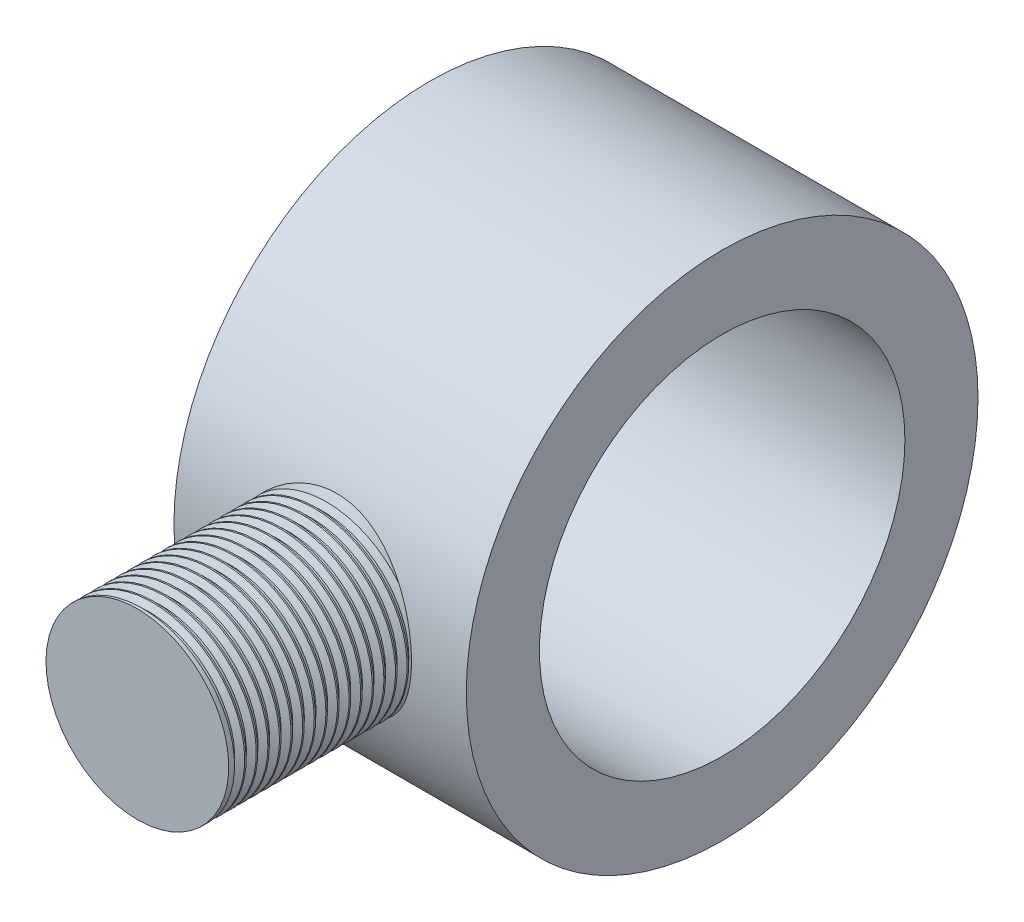
from build123d import *

# Parameters (mm, degrees)
SKETCH1_R           = 7
BOSS_EXTRUDE1_DEPTH = 8
SKETCH2_R           = 5
CUT_EXTRUDE1_DEPTH  = 13.727922061
SKETCH3_R           = 2.5
BOSS_EXTRUDE3_DEPTH = 1
BOSS_EXTRUDE4_START = 5
SKETCH4_R           = 2.5
BOSS_EXTRUDE4_DEPTH = 5
THREAD1_PITCH       = 0.3175


with BuildPart() as part:
    # Sketch1 → Boss-Extrude1 (new body)
    with BuildSketch(Plane(origin=(0, 0, 0), x_dir=(0, 0, -1), z_dir=(1, 0, 0))):
        Circle(SKETCH1_R)
    extrude(amount=BOSS_EXTRUDE1_DEPTH)

    # Sketch2 → Cut-Extrude1 (cut, through all)
    with BuildSketch(Plane(origin=(8, 0, 0), x_dir=(0, 0, -1), z_dir=(1, 0, 0))):
        Circle(SKETCH2_R)
    extrude(amount=-CUT_EXTRUDE1_DEPTH, mode=Mode.SUBTRACT)

    # Sketch3 → Boss-Extrude3 (add)
    with BuildSketch(Plane.XY.offset(7)):
        with Locations((4, 0)):
            Circle(SKETCH3_R)
    extrude(amount=-BOSS_EXTRUDE3_DEPTH)

    # Sketch4 → Boss-Extrude4 (add)
    with BuildSketch(Plane.XY.offset(7).offset(BOSS_EXTRUDE4_START)):
        with Locations((4, 0)):
            Circle(SKETCH4_R)
    extrude(amount=-BOSS_EXTRUDE4_DEPTH)

    # Thread1: the profile of Thread Profile1 profile screwed along a right-hand helix of 15.748031 turns, 6 arcs to a turn; built about Z, then put on its axis
    thread1_z = Axis((0, 0, 0), (0, 0, 1))
    thread1_corners = [(2.5003, 1e-09, -0.000173205), (2.5003, 1e-09, 0.277985704), (2.328148085, 1e-09, 0.17859375), (2.328148085, 1e-09, 0.09921875)]
    with BuildLine(mode=Mode.PRIVATE) as thread1_profile:
        Line(thread1_corners[0], thread1_corners[1])
        Line(thread1_corners[1], thread1_corners[2])
        Line(thread1_corners[2], thread1_corners[3])
        Line(thread1_corners[3], thread1_corners[0])
    thread1_cap = Face(thread1_profile.wire())
    thread1_turn_angles = [0, 30, 60, 90, 120, 150, 180, 210, 240, 270, 300, 330, 360]
    thread1_turn_weights = [1, 0.8660254037844387, 1, 0.8660254037844387, 1, 0.8660254037844387, 1, 0.8660254037844387, 1, 0.8660254037844387, 1, 0.8660254037844387, 1]
    thread1_turn_rails = [Edge.make_bspline([Vector(p[0], p[1], 0).rotate(thread1_z, thread1_turn_angles[k]) / thread1_turn_weights[k] + Vector(0, 0, p[2] + THREAD1_PITCH * thread1_turn_angles[k] / 360) for k in range(13)], [0, 0, 0, 1, 1, 2, 2, 3, 3, 4, 4, 5, 5, 6, 6, 6], 2, thread1_turn_weights) for p in thread1_corners]
    thread1_turn_sides = [Face.make_surface_from_curves(thread1_turn_rails[p[0]], thread1_turn_rails[p[1]]) for p in [(0, 1), (1, 2), (2, 3), (3, 0)]]
    thread1_last_angles = [5400, 5430, 5460, 5490, 5520, 5550, 5580, 5610, 5640, 5654.645669291, 5669.291338583]
    thread1_last_weights = [1, 0.8660254037844387, 1, 0.8660254037844387, 1, 0.8660254037844387, 1, 0.8660254037844387, 1, 0.9675079437748935, 1]
    thread1_last_rails = [Edge.make_bspline([Vector(p[0], p[1], 0).rotate(thread1_z, thread1_last_angles[k]) / thread1_last_weights[k] + Vector(0, 0, p[2] + THREAD1_PITCH * thread1_last_angles[k] / 360) for k in range(11)], [0, 0, 0, 1, 1, 2, 2, 3, 3, 4, 4, 5, 5, 5], 2, thread1_last_weights) for p in thread1_corners]
    thread1_last_sides = [Face.make_surface_from_curves(thread1_last_rails[p[0]], thread1_last_rails[p[1]]) for p in [(0, 1), (1, 2), (2, 3), (3, 0)]]
    thread1 = Plane(origin=(4, 0, 12), x_dir=(-0.999847695, 0.017452406, 0), z_dir=(0, 0, -1)) * Solid(Shell([*[p.moved(Location((0, 0, THREAD1_PITCH * i))) for i in range(15) for p in thread1_turn_sides], *thread1_last_sides, thread1_cap, thread1_cap.rotate(thread1_z, 5669.291338583).moved(Location((0, 0, THREAD1_PITCH * 5669.291338583 / 360)))]))
    add(thread1, mode=Mode.SUBTRACT)


solid = part.part
